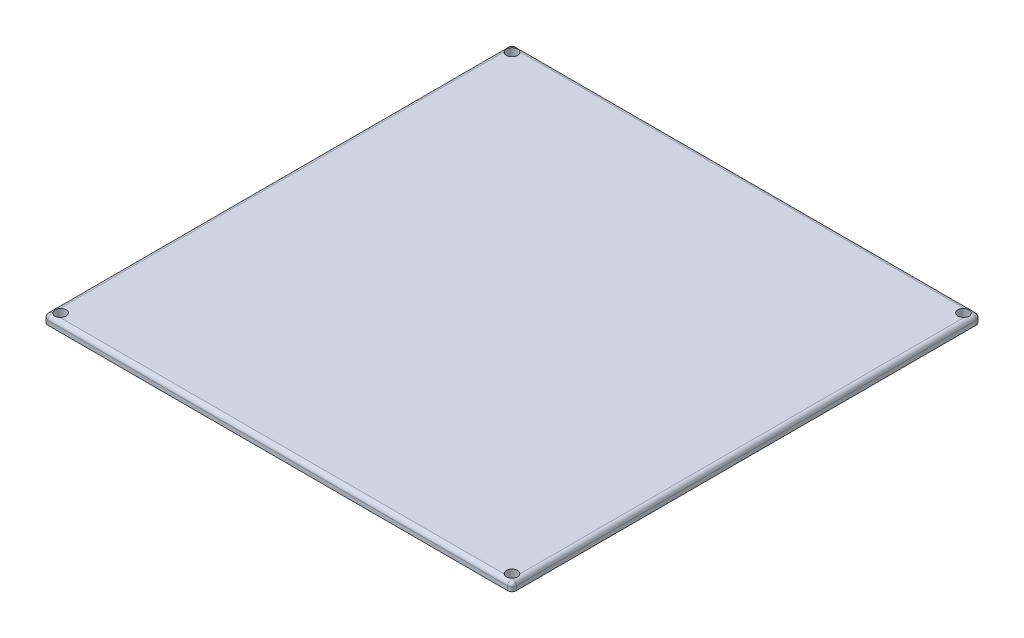
from build123d import *

# Parameters (mm, degrees)
ESQUISSE1_W        = 110
ESQUISSE1_H        = 110
ESQUISSE1_R        = 1.3
BOSS_EXTRU_1_DEPTH = 2
CONG_2_R           = 1
CONG_3_R           = 1
CONG_5_R           = 1


with BuildPart() as part:
    # Esquisse1 → Boss.-Extru.1 (new body)
    with BuildSketch(Plane(origin=(0, 0, 0), x_dir=(1, 0, 0), z_dir=(0, 1, 0))):
        with Locations((-3.4375, -19.765625)):
            Rectangle(ESQUISSE1_W, ESQUISSE1_H)
        with Locations(Location((-56.4375, 33.234375, 0), (0, 0, 270))):
            Circle(ESQUISSE1_R, mode=Mode.SUBTRACT)
        with Locations(Location((49.5625, 33.234375, 0), (0, 0, 270))):
            Circle(ESQUISSE1_R, mode=Mode.SUBTRACT)
        with Locations(Location((-56.4375, -72.765625, 0), (0, 0, 270))):
            Circle(ESQUISSE1_R, mode=Mode.SUBTRACT)
        with Locations(Location((49.5625, -72.765625, 0), (0, 0, 270))):
            Circle(ESQUISSE1_R, mode=Mode.SUBTRACT)
    extrude(amount=BOSS_EXTRU_1_DEPTH)

    # Congé2
    cong_2_edges = [part.edges().sort_by_distance(p)[0] for p in [
        (-58.4375, 1, 74.765625),
    ]]
    fillet(cong_2_edges, radius=CONG_2_R)

    # Congé3
    cong_3_edges = [part.edges().sort_by_distance(p)[0] for p in [
        (-58.4375, 1, -35.234375),
        (51.5625, 1, -35.234375),
        (51.5625, 1, 74.765625),
    ]]
    fillet(cong_3_edges, radius=CONG_3_R)

    # Congé5
    # the kernel refuses this fillet: 1 mm, written as the material it takes off along each edge
    with BuildSketch(Plane(origin=(50.5625, 2, 74.765625), x_dir=(0, -1, 0), z_dir=(-1, 0, 0))) as cong_5_piece_1:
        with BuildLine():
            CenterArc((CONG_5_R, -CONG_5_R), CONG_5_R, 90, 90)
            Line((0, -CONG_5_R), (0, 0))
            Line((0, 0), (CONG_5_R, 0))
        make_face()
    extrude(amount=108, mode=Mode.SUBTRACT)
    with BuildSketch(Plane(origin=(-57.4375, 2, 73.765625), x_dir=(0, 0, 1), z_dir=(1, 0, 0))) as cong_5_piece_2:
        with BuildLine():
            CenterArc((1 - CONG_5_R, CONG_5_R), CONG_5_R, 270, 90)
            Line((1 - CONG_5_R, 0), (1, 0))
            Line((1, 0), (1, CONG_5_R))
        make_face()
    revolve(axis=Axis((-57.4375, 2, 73.765625), (0, -1, 0)), revolution_arc=90, mode=Mode.SUBTRACT)
    with BuildSketch(Plane(origin=(-58.4375, 2, 73.765625), x_dir=(1, 0, 0), z_dir=(0, 0, -1)), Plane(origin=(-57.4375, 2, -35.234375), x_dir=(0, 0, 1), z_dir=(1, 0, 0)), Plane(origin=(51.5625, 2, -34.234375), x_dir=(-1, 0, 0), z_dir=(0, 0, 1))) as cong_5_piece_3:
        with BuildLine():
            CenterArc((CONG_5_R, CONG_5_R), CONG_5_R, 180, 90)
            Line((0, CONG_5_R), (0, 0))
            Line((0, 0), (CONG_5_R, 0))
        make_face()
    extrude(amount=108, mode=Mode.SUBTRACT)
    with BuildSketch(Plane(origin=(50.5625, 2, 73.765625), x_dir=(0, 0, 1), z_dir=(-1, 0, 0))) as cong_5_piece_4:
        with BuildLine():
            CenterArc((1 - CONG_5_R, -CONG_5_R), CONG_5_R, 0, 90)
            Line((1 - CONG_5_R, 0), (1, 0))
            Line((1, 0), (1, -CONG_5_R))
        make_face()
    revolve(axis=Axis((50.5625, 2, 73.765625), (0, 1, 0)), revolution_arc=90, mode=Mode.SUBTRACT)
    with BuildSketch(Plane(origin=(50.5625, 2, -34.234375), x_dir=(1, 0, 0), z_dir=(0, 0, 1))) as cong_5_piece_5:
        with BuildLine():
            CenterArc((1 - CONG_5_R, -CONG_5_R), CONG_5_R, 0, 90)
            Line((1, -CONG_5_R), (1, 0))
            Line((1, 0), (1 - CONG_5_R, 0))
        make_face()
    revolve(axis=Axis((50.5625, 2, -34.234375), (0, 1, 0)), revolution_arc=90, mode=Mode.SUBTRACT)
    with BuildSketch(Plane(origin=(-57.4375, 2, -34.234375), x_dir=(-1, 0, 0), z_dir=(0, 0, 1))) as cong_5_piece_6:
        with BuildLine():
            CenterArc((1 - CONG_5_R, CONG_5_R), CONG_5_R, 270, 90)
            Line((1, CONG_5_R), (1, 0))
            Line((1, 0), (1 - CONG_5_R, 0))
        make_face()
    revolve(axis=Axis((-57.4375, 2, -34.234375), (0, -1, 0)), revolution_arc=90, mode=Mode.SUBTRACT)


solid = part.part
